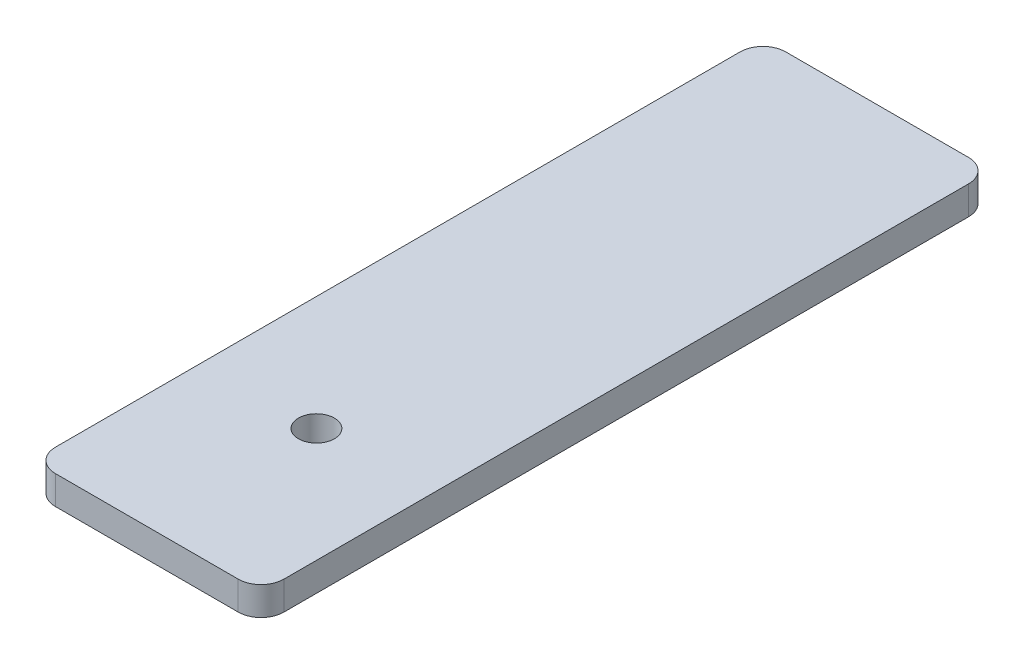
from build123d import *

# Parameters (mm, degrees)
SKETCH1_W           = 25.4
SKETCH1_H           = 81.175
BOSS_EXTRUDE1_DEPTH = 3.175
SKETCH2_R           = 2
CUT_EXTRUDE1_DEPTH  = 63.137257853
FILLET1_R           = 2.54


with BuildPart() as part:
    # Sketch1 → Boss-Extrude1 (new body)
    with BuildSketch(Plane(origin=(0, 0, 0), x_dir=(1, 0, 0), z_dir=(0, 1, 0))):
        with Locations((-13.581081081, 15.628716216)):
            Rectangle(SKETCH1_W, SKETCH1_H)
    extrude(amount=BOSS_EXTRUDE1_DEPTH)

    # Sketch2 → Cut-Extrude1 (cut, through all)
    with BuildSketch(Plane(origin=(0, 3.175, 0), x_dir=(1, 0, 0), z_dir=(0, 1, 0))):
        with Locations((-13.581081081, -6.108783784)):
            Circle(SKETCH2_R)
    extrude(amount=-CUT_EXTRUDE1_DEPTH, mode=Mode.SUBTRACT)

    # Fillet1
    fillet1_edges = [part.edges().sort_by_distance(p)[0] for p in [
        (-26.281081081, 1.5875, -56.216216216),
        (-0.881081081, 1.5875, -56.216216216),
        (-0.881081081, 1.5875, 24.958783784),
        (-26.281081081, 1.5875, 24.958783784),
    ]]
    fillet(fillet1_edges, radius=FILLET1_R)


solid = part.part
